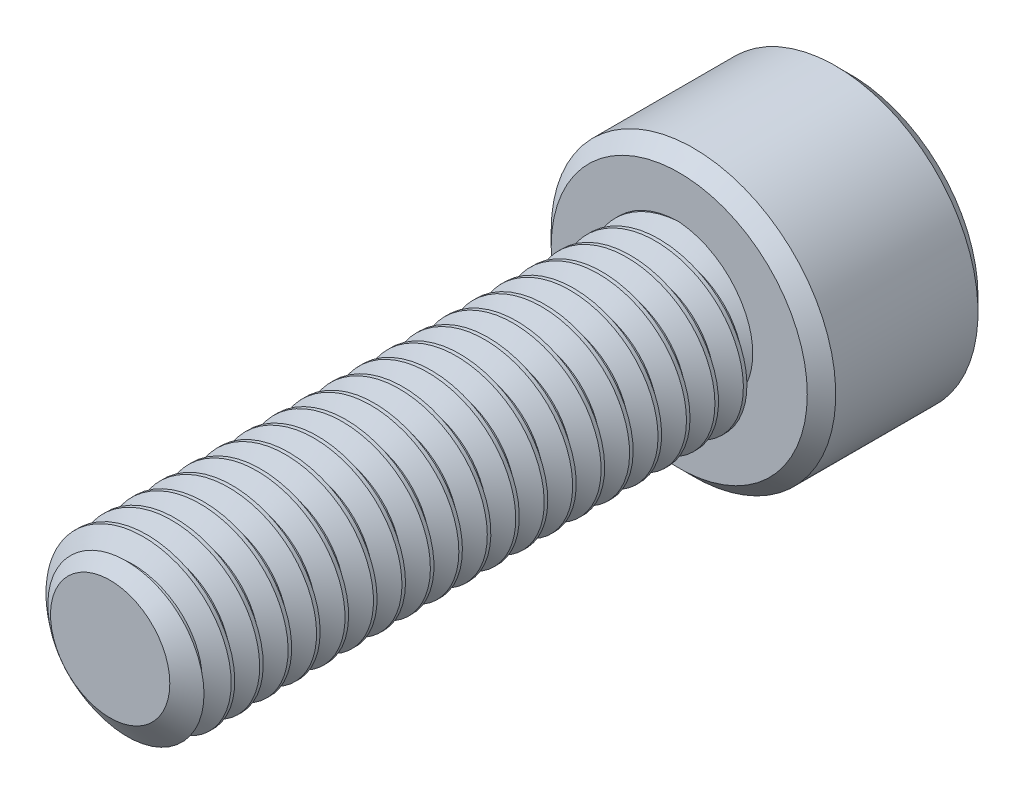
from build123d import *

# Parameters (mm, degrees)
SKETCH1_R          = 3
EXTRUDE1_DEPTH     = 20
CUT_SWEEP1_PITCH   = 1
SKETCH6_R          = 5
EXTRUDE2_DEPTH     = 6
CUT_EXTRUDE1_DEPTH = 3.75
CHAMFER1_SIZE      = 0.5


with BuildPart() as part:
    # Sketch1 → Extrude1 (new body)
    with BuildSketch(Plane.XY):
        Circle(SKETCH1_R)
    extrude(amount=-EXTRUDE1_DEPTH)

    # Cut-Sweep1: arcs per turn and ends read off the stored shape
    # Cut-Sweep1: the profile of Sketch3 profile screwed along a right-hand helix through 23 turns, 6 arcs to a turn; built about Z, then put on its axis
    cut_sweep1_z = Axis((0, 0, 0), (0, 0, 1))
    cut_sweep1_corners = [(3.0003, 0, -1.875173205), (2.350480947, 0, -1.5), (2.350480947, 0, -1.375), (3.0003, 0, -0.999826795)]
    with BuildLine(mode=Mode.PRIVATE) as cut_sweep1_profile:
        Line(cut_sweep1_corners[0], cut_sweep1_corners[1])
        Line(cut_sweep1_corners[1], cut_sweep1_corners[2])
        Line(cut_sweep1_corners[2], cut_sweep1_corners[3])
        Line(cut_sweep1_corners[3], cut_sweep1_corners[0])
    cut_sweep1_cap = Face(cut_sweep1_profile.wire())
    cut_sweep1_turn_angles = [0, 30, 60, 90, 120, 150, 180, 210, 240, 270, 300, 330, 360]
    cut_sweep1_turn_weights = [1, 0.8660254037844387, 1, 0.8660254037844387, 1, 0.8660254037844387, 1, 0.8660254037844387, 1, 0.8660254037844387, 1, 0.8660254037844387, 1]
    cut_sweep1_turn_rails = [Edge.make_bspline([Vector(p[0], p[1], 0).rotate(cut_sweep1_z, cut_sweep1_turn_angles[k]) / cut_sweep1_turn_weights[k] + Vector(0, 0, p[2] + CUT_SWEEP1_PITCH * cut_sweep1_turn_angles[k] / 360) for k in range(13)], [0, 0, 0, 1, 1, 2, 2, 3, 3, 4, 4, 5, 5, 6, 6, 6], 2, cut_sweep1_turn_weights) for p in cut_sweep1_corners]
    cut_sweep1_turn_sides = [Face.make_surface_from_curves(cut_sweep1_turn_rails[p[0]], cut_sweep1_turn_rails[p[1]]) for p in [(0, 1), (1, 2), (2, 3), (3, 0)]]
    cut_sweep1 = Plane(origin=(0, 0, 0), x_dir=(0, 1, 0), z_dir=(0, 0, -1)) * Solid(Shell([*[p.moved(Location((0, 0, CUT_SWEEP1_PITCH * i))) for i in range(23) for p in cut_sweep1_turn_sides], cut_sweep1_cap, cut_sweep1_cap.rotate(cut_sweep1_z, 8280).moved(Location((0, 0, CUT_SWEEP1_PITCH * 8280 / 360)))]))
    add(cut_sweep1, mode=Mode.SUBTRACT)

    # Sketch4 → Cut-Revolve1 (revolve, cut)
    with BuildSketch(Plane(origin=(0, 0, 0), x_dir=(0, 0, -1), z_dir=(1, 0, 0)), mode=Mode.PRIVATE) as cut_revolve1_sk:
        Polygon((0.632650852, 3), (0, 2.096480947), (0, 3), align=None)
    revolve(cut_revolve1_sk.sketch.rotate(Axis((0, 0, 0), (0, 0, -1)), 270), axis=Axis((0, 0, 0), (0, 0, -1)), mode=Mode.SUBTRACT)

    # Sketch6 → Extrude2 (add)
    with BuildSketch(Plane(origin=(0, 0, -20), x_dir=(-1, 0, 0), z_dir=(0, 0, -1))):
        Circle(SKETCH6_R)
    extrude(amount=EXTRUDE2_DEPTH)

    # Sketch7 → Cut-Extrude1 (cut)
    with BuildSketch(Plane(origin=(0, 0, -26), x_dir=(-1, 0, 0), z_dir=(0, 0, -1))):
        Polygon((0, 2.886751346), (-2.5, 1.443375673), (-2.5, -1.443375673), (0, -2.886751346), (2.5, -1.443375673), (2.5, 1.443375673), align=None)
    extrude(amount=-CUT_EXTRUDE1_DEPTH, mode=Mode.SUBTRACT)

    # Cut-Extrude2 cone 1 section (through the dimple's axis) → Cut-Extrude2 (revolve, cut)
    with BuildSketch(Plane(origin=(0, 0, -26), x_dir=(0, 1, 0), z_dir=(1, 0, 0))):
        Polygon((0, 0), (2.886751346, 0), (0, 2.886751346), align=None)
    revolve(axis=Axis((0, 0, -26), (0, 0, 1)), mode=Mode.SUBTRACT)

    # Chamfer1
    chamfer1_edges = [part.edges().sort_by_distance(p)[0] for p in [
        (5, 0, -20),
        (5, 0, -26),
    ]]
    chamfer(chamfer1_edges, length=CHAMFER1_SIZE)


solid = part.part
